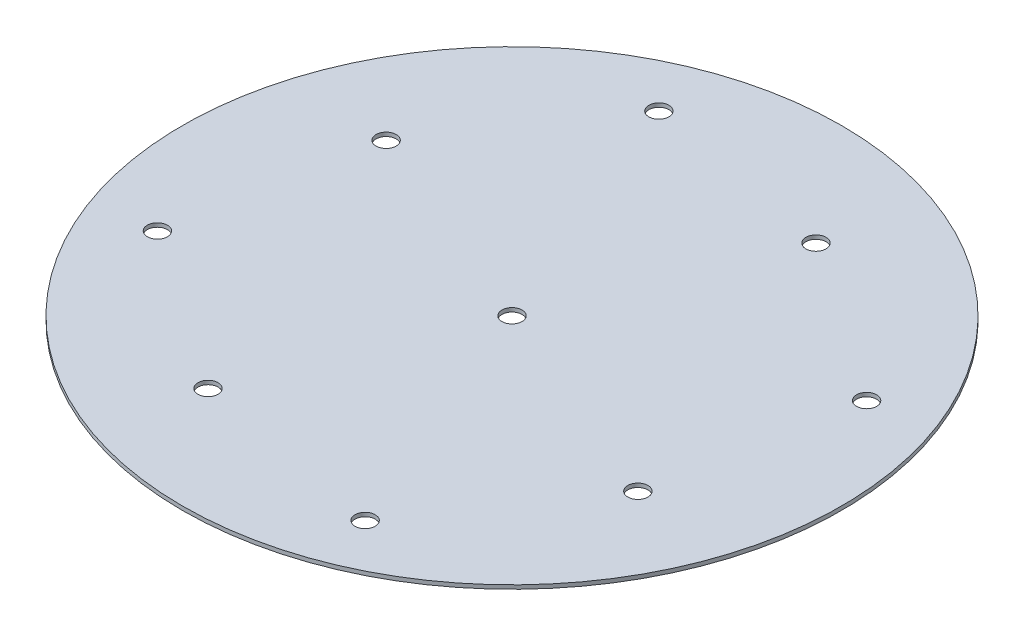
from build123d import *

# Parameters (mm, degrees)
SKETCH2_W                  = 84.99983
SKETCH2_H                  = 1
F_6_0_204_DIAMETER_HOLE1_D = 5.1816
CIRPATTERN3_COUNT          = 4
F_6_0_204_DIAMETER_HOLE2_D = 5.1816


with BuildPart() as part:
    # Sketch2 → Revolve1 (revolve)
    with BuildSketch(Plane(origin=(0, 0, 0), x_dir=(0, 0, -1), z_dir=(1, 0, 0))):
        with Locations((-42.499915, 0.5)):
            Rectangle(SKETCH2_W, SKETCH2_H)
    revolve(axis=Axis((0, -0.05, 0), (0, 1, 0)))

    # #6 (0.204) Diameter Hole1 (through all)
    with Locations(Plane(origin=(0, 1, 0), x_dir=(1, 0, 0), z_dir=(0, 1, 0))):
        with Locations((-26.787840266, 64.671567276), (264.743675233, 73.787758551), (-55.432771951, 22.961005942)):
            f_6_0_204_diameter_hole1 = Hole(F_6_0_204_DIAMETER_HOLE1_D / 2)

    # CirPattern3: #6 (0.204) Diameter Hole1 ×4 about axis
    cirpattern3_axis = Axis((0, -0.05, 0), (0, 1, 0))
    for i in range(1, CIRPATTERN3_COUNT):
        add(f_6_0_204_diameter_hole1.rotate(cirpattern3_axis, i * 360 / CIRPATTERN3_COUNT), mode=Mode.SUBTRACT)

    # #6 (0.204) Diameter Hole2 (through all)
    with Locations(Plane(origin=(0, 1, 0), x_dir=(1, 0, 0), z_dir=(0, 1, 0))):
        with Locations((0, 0)):
            Hole(F_6_0_204_DIAMETER_HOLE2_D / 2)


solid = part.part
